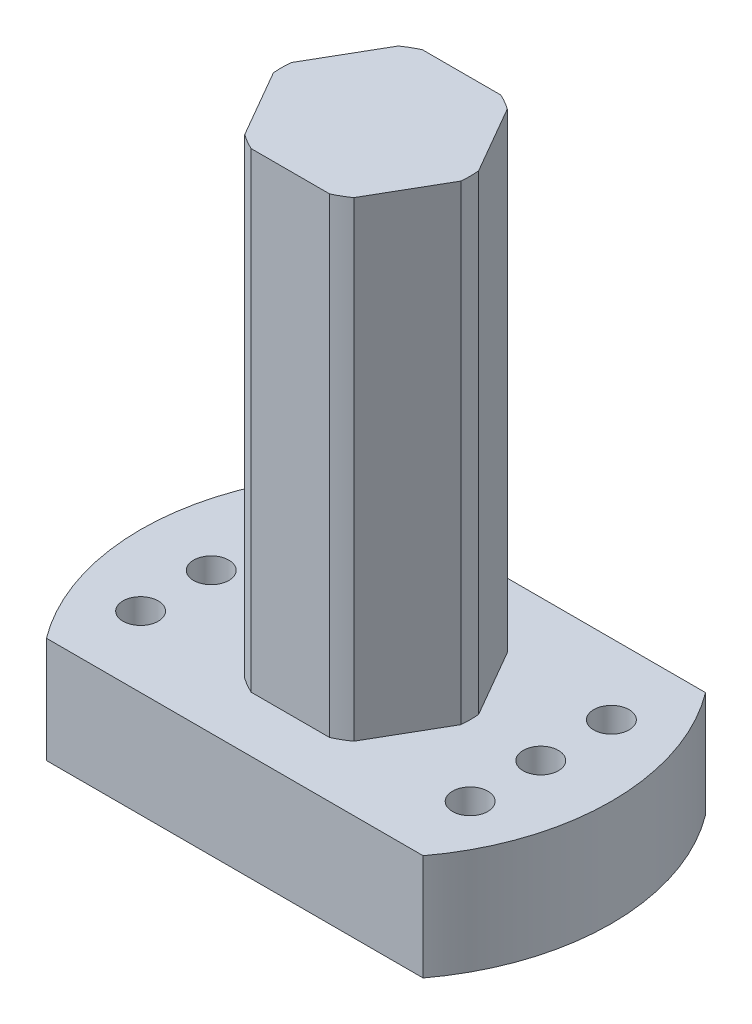
from build123d import *

# Parameters (mm, degrees)
SKETCH_1_R      = 0.75
EXTRUDE_1_DEPTH = 4.5
EXTRUDE_2_DEPTH = 20


with BuildPart() as part:
    # Эскиз1 → Бобышка-Вытянуть1 (new body)
    with BuildSketch(Plane(origin=(0, 0, 0), x_dir=(1, 0, 0), z_dir=(0, 1, 0))):
        with BuildLine():
            Line((-8, 6), (8, 6))
            ThreePointArc((8, 6), (10, 0), (8, -6))
            Line((8, -6), (-8, -6))
            ThreePointArc((-8, -6), (-10, 0), (-8, 6))
        make_face()
        with Locations((-7, 3)):
            Circle(SKETCH_1_R, mode=Mode.SUBTRACT)
        with Locations((-7, 0)):
            Circle(SKETCH_1_R, mode=Mode.SUBTRACT)
        with Locations((-7, -3)):
            Circle(SKETCH_1_R, mode=Mode.SUBTRACT)
        with Locations((7, -3)):
            Circle(SKETCH_1_R, mode=Mode.SUBTRACT)
        with Locations((7, 0)):
            Circle(SKETCH_1_R, mode=Mode.SUBTRACT)
        with Locations((7, 3)):
            Circle(SKETCH_1_R, mode=Mode.SUBTRACT)
    extrude(amount=EXTRUDE_1_DEPTH)

    # Эскиз2 → Бобышка-Вытянуть2 (add)
    with BuildSketch(Plane(origin=(0, 4.5, 0), x_dir=(1, 0, 0), z_dir=(0, 1, 0))):
        with BuildLine():
            Line((1.664331698, 3.637306696), (-1.664331698, 3.637306696))
            ThreePointArc((-1.664331698, 3.637306696), (-2, 3.464101615), (-2.317834151, 3.260006878))
            Line((-2.317834151, 3.260006878), (-3.982165849, 0.377299817))
            ThreePointArc((-3.982165849, 0.377299817), (-4, 0), (-3.982165849, -0.377299817))
            Line((-3.982165849, -0.377299817), (-2.317834151, -3.260006878))
            ThreePointArc((-2.317834151, -3.260006878), (-2, -3.464101615), (-1.664331698, -3.637306696))
            Line((-1.664331698, -3.637306696), (1.664331698, -3.637306696))
            ThreePointArc((1.664331698, -3.637306696), (2, -3.464101615), (2.317834151, -3.260006878))
            Line((2.317834151, -3.260006878), (3.982165849, -0.377299817))
            ThreePointArc((3.982165849, -0.377299817), (4, 0), (3.982165849, 0.377299817))
            Line((3.982165849, 0.377299817), (2.317834151, 3.260006878))
            ThreePointArc((2.317834151, 3.260006878), (2, 3.464101615), (1.664331698, 3.637306696))
        make_face()
    extrude(amount=EXTRUDE_2_DEPTH)


solid = part.part
